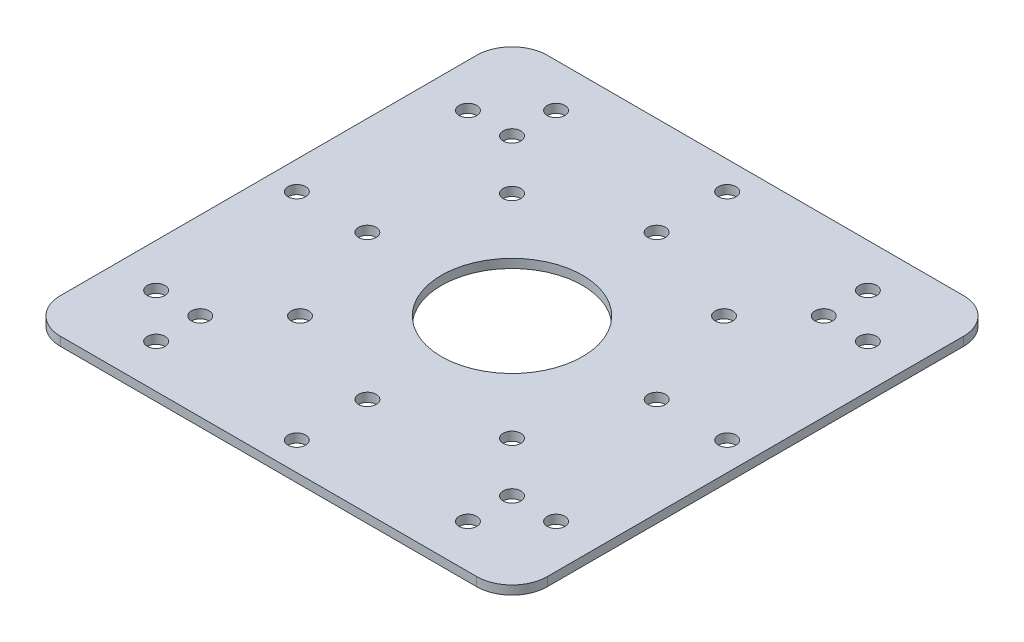
from build123d import *

# Parameters (mm, degrees)
BOSS_EXTRUDE1_DEPTH = 1.27
SKETCH2_R           = 10.16
SKETCH2_R_2         = 1.27
CUT_EXTRUDE1_DEPTH  = 50.5872797


with BuildPart() as part:
    # Sketch1 → Boss-Extrude1 (new body)
    with BuildSketch(Plane(origin=(0, 0, 0), x_dir=(1, 0, 0), z_dir=(0, 1, 0))):
        with BuildLine():
            Line((29.972, -35.052), (-29.972, -35.052))
            ThreePointArc((-29.972, -35.052), (-33.564102448, -33.564102448), (-35.052, -29.972))
            Line((-35.052, -29.972), (-35.052, 29.972))
            ThreePointArc((-35.052, 29.972), (-33.564102448, 33.564102448), (-29.972, 35.052))
            Line((-29.972, 35.052), (29.972, 35.052))
            ThreePointArc((29.972, 35.052), (33.564102448, 33.564102448), (35.052, 29.972))
            Line((35.052, 29.972), (35.052, -29.972))
            ThreePointArc((35.052, -29.972), (33.564102448, -33.564102448), (29.972, -35.052))
        make_face()
    extrude(amount=BOSS_EXTRUDE1_DEPTH)

    # Sketch2 → Cut-Extrude1 (cut, through all)
    with BuildSketch(Plane(origin=(0, 1.27, 0), x_dir=(1, 0, 0), z_dir=(0, 1, 0))):
        Circle(SKETCH2_R)
        with Locations((20.833792189, 0)):
            Circle(SKETCH2_R_2)
        with Locations((30.988, 0)):
            Circle(SKETCH2_R_2)
        with Locations((-20.833792189, 0)):
            Circle(SKETCH2_R_2)
        with Locations((-30.988, 0)):
            Circle(SKETCH2_R_2)
        with Locations((0, -20.828)):
            Circle(SKETCH2_R_2)
        with Locations((0, 20.828)):
            Circle(SKETCH2_R_2)
        with Locations((-15.266435406, -15.266435406)):
            Circle(SKETCH2_R_2)
        with Locations((-22.450640303, -22.450640303)):
            Circle(SKETCH2_R_2)
        with Locations((-28.800640303, -22.450640303)):
            Circle(SKETCH2_R_2)
        with Locations((-22.450640303, -28.800640303)):
            Circle(SKETCH2_R_2)
        with Locations((28.800640303, -22.450640303)):
            Circle(SKETCH2_R_2)
        with Locations((22.450640303, -28.800640303)):
            Circle(SKETCH2_R_2)
        with Locations((22.450640303, -22.450640303)):
            Circle(SKETCH2_R_2)
        with Locations((15.266435406, -15.266435406)):
            Circle(SKETCH2_R_2)
        with Locations((28.800640303, 22.450640303)):
            Circle(SKETCH2_R_2)
        with Locations((22.450640303, 28.800640303)):
            Circle(SKETCH2_R_2)
        with Locations((22.450640303, 22.450640303)):
            Circle(SKETCH2_R_2)
        with Locations((15.266435406, 15.266435406)):
            Circle(SKETCH2_R_2)
        with Locations((-22.450640303, 28.800640303)):
            Circle(SKETCH2_R_2)
        with Locations((-28.800640303, 22.450640303)):
            Circle(SKETCH2_R_2)
        with Locations((-15.266435406, 15.266435406)):
            Circle(SKETCH2_R_2)
        with Locations((-22.450640303, 22.450640303)):
            Circle(SKETCH2_R_2)
        with Locations((0, 30.988)):
            Circle(SKETCH2_R_2)
        with Locations((0, -30.988)):
            Circle(SKETCH2_R_2)
    extrude(amount=-CUT_EXTRUDE1_DEPTH, mode=Mode.SUBTRACT)


solid = part.part
